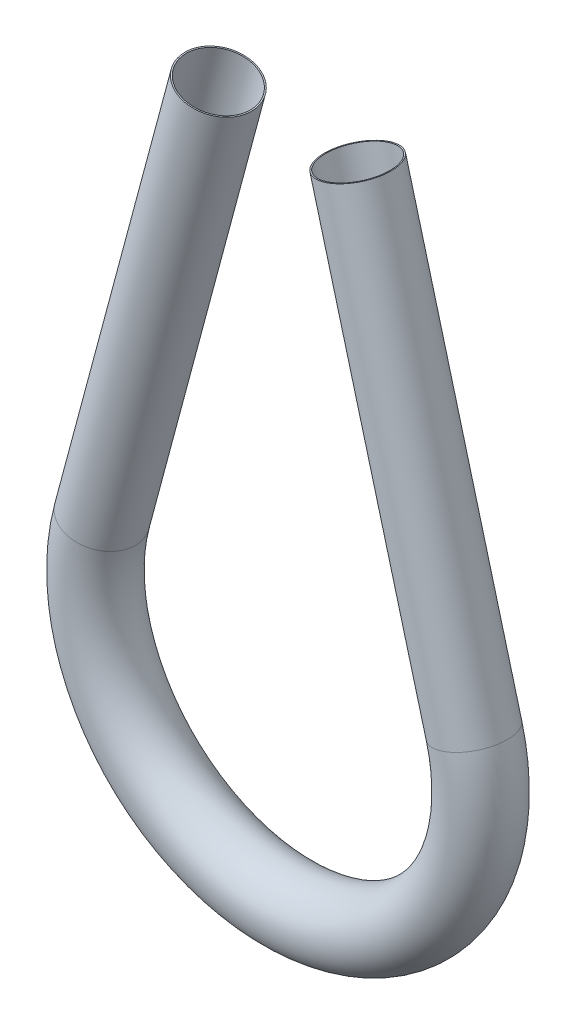
from build123d import *

# Parameters (mm, degrees)
SKETCH2_R   = 6.604
SKETCH2_R_2 = 6.35


with BuildPart() as part:
    # Sweep1: sweep along a path in Sketch1
    with BuildLine(Plane.XY) as sweep1_path:
        Line((-137.341657843, -9.296288517), (-159.618955177, -92.436294023))
        ThreePointArc((-159.618955177, -92.436294023), (-124.004465969, -138.85), (-88.389976761, -92.436294023))
        Line((-88.389976761, -92.436294023), (-110.667274096, -9.296288517))
    # Sketch2 → Sweep1 (sweep)
    with BuildSketch(Plane(origin=(-110.667274096, -9.296288517, 0), x_dir=(-0.96592582628907, -0.25881904510251436, 0), z_dir=(0.25881904510251436, -0.96592582628907, 0))):
        Circle(SKETCH2_R)
        Circle(SKETCH2_R_2, mode=Mode.SUBTRACT)
    sweep(path=sweep1_path.line)


solid = part.part
